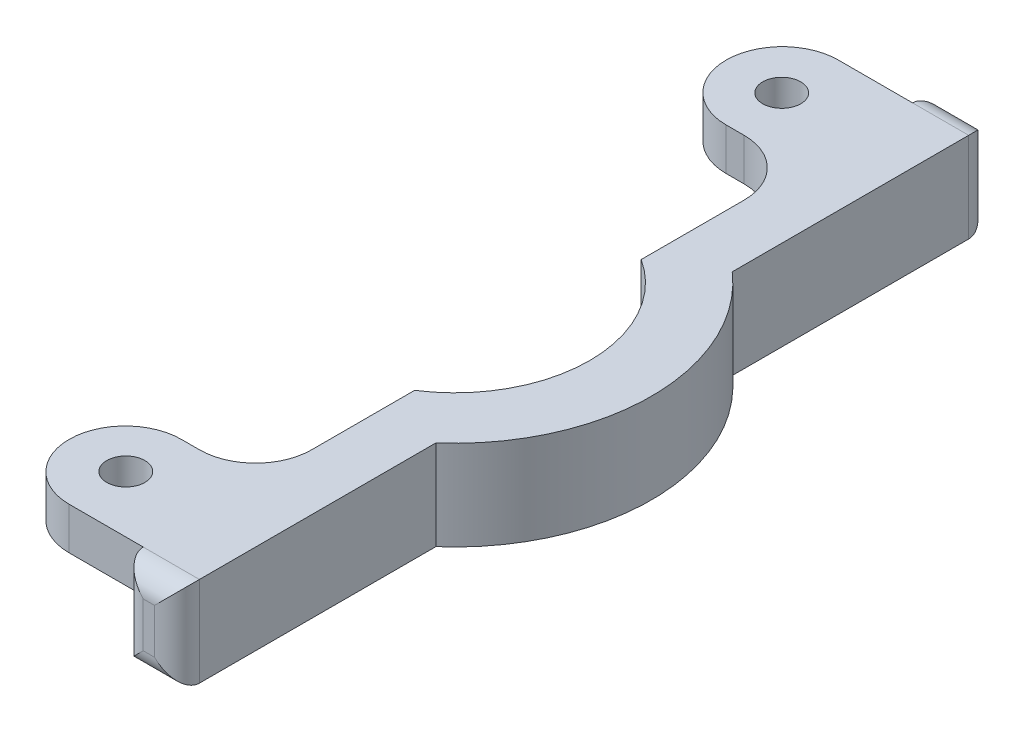
from build123d import *

# Parameters (mm, degrees)
SKETCH1_R            = 22.225
SKETCH1_R_2          = 15.24
BOSS_EXTRUDE1_DEPTH  = 5.08
SKETCH6_W            = 64.917410467
SKETCH6_H            = 82.171101747
CUT_EXTRUDE2_DEPTH   = 32.838775887
BOSS_EXTRUDE3_DEPTH  = 5.08
MIRROR2_COPY_1_DEPTH = 5.08
FILLET5_R            = 2.54
SKETCH15_W           = 12.7
SKETCH15_H           = 4.7625
BOSS_EXTRUDE5_DEPTH  = 14.732
SKETCH17_R           = 2.15265
CUT_EXTRUDE5_DEPTH   = 12.7
FILLET6_R            = 6.35
FILLET6_OF_MIRROR3_R = 6.35


with BuildPart() as part:
    # Sketch1 → Boss-Extrude1 (new body)
    with BuildSketch(Plane(origin=(0, 0, 0), x_dir=(1, 0, 0), z_dir=(0, 1, 0))):
        with Locations(Location((0, 0, 0), (0, 0, 270))):
            Circle(SKETCH1_R)
        with Locations(Location((0, 0, 0), (0, 0, 270))):
            Circle(SKETCH1_R_2, mode=Mode.SUBTRACT)
    boss_extrude1 = extrude(amount=BOSS_EXTRUDE1_DEPTH)

    # Sketch6 → Cut-Extrude2 (cut, through all)
    with BuildSketch(Plane(origin=(0, 5.08, 0), x_dir=(1, 0, 0), z_dir=(0, 1, 0))):
        with Locations((-24.203705233, -1.153387837)):
            Rectangle(SKETCH6_W, SKETCH6_H)
    cut_extrude2 = extrude(amount=-CUT_EXTRUDE2_DEPTH, mode=Mode.SUBTRACT)

    # Sketch9 → Boss-Extrude3 (add)
    with BuildSketch(Plane(origin=(0, 5.08, 0), x_dir=(1, 0, 0), z_dir=(0, 1, 0))):
        Polygon((8.255, 20.635057548), (8.255, 46.035057548), (14.605, 46.035057548), (14.605, 16.752450567), align=None)
    boss_extrude3 = extrude(amount=-BOSS_EXTRUDE3_DEPTH)

    # Mirror1: Boss-Extrude3 across plane
    add(boss_extrude3.mirror(Plane.XY))

    # Mirror2: Boss-Extrude1, Cut-Extrude2, Boss-Extrude3 across plane
    add(boss_extrude1.mirror(Plane.ZX))
    add(cut_extrude2.mirror(Plane.ZX), mode=Mode.SUBTRACT)
    add(boss_extrude3.mirror(Plane.ZX))

    # Mirror2 copy 1 sketch → Mirror2 copy 1 (add)
    with BuildSketch(Plane.XZ.offset(5.08)):
        Polygon((8.255, 20.635057548), (8.255, 46.035057548), (14.605, 46.035057548), (14.605, 16.752450567), align=None)
    extrude(amount=-MIRROR2_COPY_1_DEPTH)

    # Fillet5
    fillet5_edges = [part.edges().sort_by_distance(p)[0] for p in [
        (11.43, -5.08, -46.035057548),
        (11.43, -5.08, 46.035057548),
        (11.43, 5.08, -46.035057548),
        (8.255, 0, -46.035057548),
        (14.605, 0, -46.035057548),
        (11.43, 5.08, 46.035057548),
        (14.605, 0, 46.035057548),
        (8.255, 0, 46.035057548),
    ]]
    fillet(fillet5_edges, radius=FILLET5_R)

    # Sketch15 → Boss-Extrude5 (add)
    with BuildSketch(Plane.ZY.offset(-8.255)):
        with Locations((-37.145057548, 2.69875)):
            Rectangle(SKETCH15_W, SKETCH15_H)
    boss_extrude5 = extrude(amount=BOSS_EXTRUDE5_DEPTH)

    # Sketch17 → Cut-Extrude5 (cut)
    with BuildSketch(Plane(origin=(0, 5.08, 0), x_dir=(1, 0, 0), z_dir=(0, 1, 0))):
        with Locations(Location((-0.127, 37.084, 0), (0, 0, 270))):
            Circle(SKETCH17_R)
    cut_extrude5 = extrude(amount=-CUT_EXTRUDE5_DEPTH, mode=Mode.SUBTRACT)

    # Fillet6
    fillet6_edges = [part.edges().sort_by_distance(p)[0] for p in [
        (8.255, 2.69875, -30.795057548),
        (-6.477, 2.69875, -30.795057548),
        (-6.477, 2.69875, -43.495057548),
    ]]
    fillet(fillet6_edges, radius=FILLET6_R - 0.0001)  # a hair under: the kernel refuses the full size

    # Mirror3: Boss-Extrude5, Cut-Extrude5 across plane
    add(boss_extrude5.mirror(Plane.XY))
    add(cut_extrude5.mirror(Plane.XY), mode=Mode.SUBTRACT)

    # Fillet6 of Mirror3
    fillet6_of_mirror3_edges = [part.edges().sort_by_distance(p)[0] for p in [
        (8.255, 2.69875, 30.795057548),
        (-6.477, 2.69875, 30.795057548),
        (-6.477, 2.69875, 43.495057548),
    ]]
    fillet(fillet6_of_mirror3_edges, radius=FILLET6_OF_MIRROR3_R - 0.0001)  # a hair under: the kernel refuses the full size


solid = part.part
